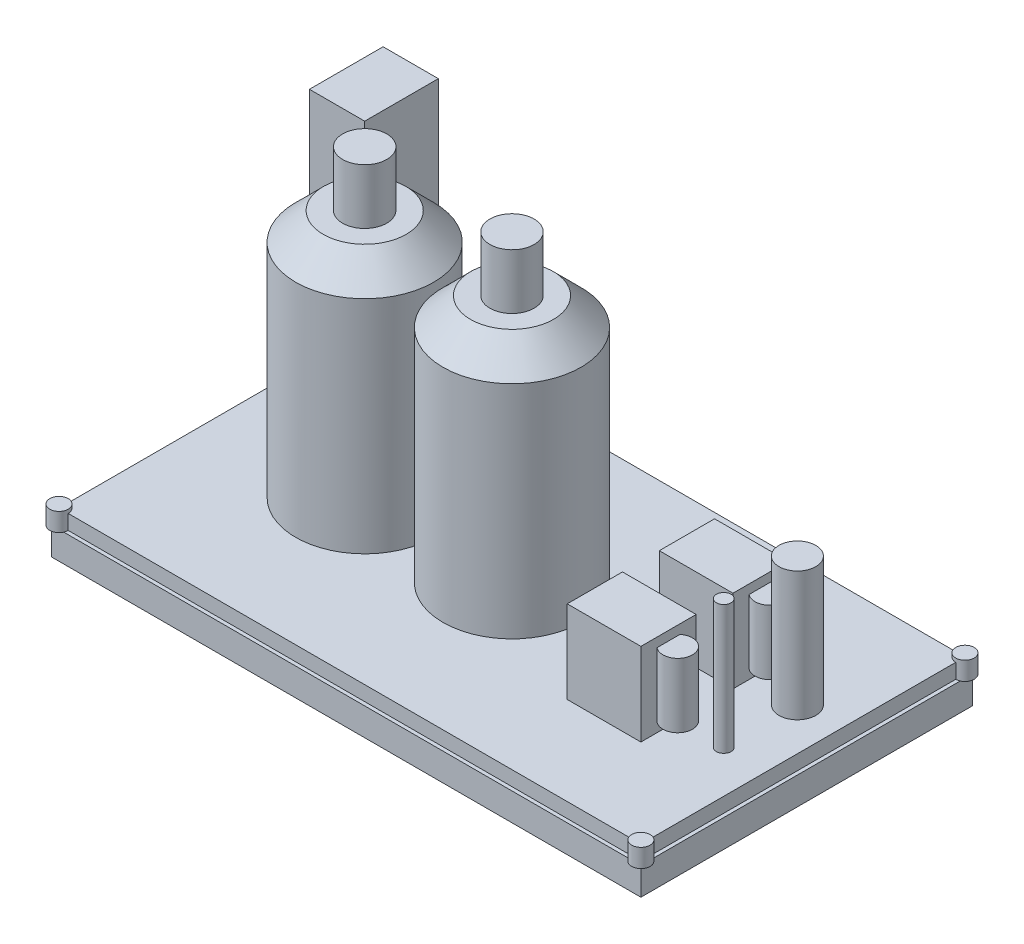
from build123d import *

# Parameters (mm, degrees)
SKETCH1_W                     = 3200
SKETCH1_H                     = 1800
BOSS_EXTRUDE1_DEPTH           = 150
BOSS_EXTRUDE2_START           = 150
SKETCH2_W                     = 3160
SKETCH2_H                     = 1760
BOSS_EXTRUDE2_DEPTH           = 80
BOSS_EXTRUDE3_START           = 15
SKETCH3_W                     = 200
SKETCH3_H                     = 1800
BOSS_EXTRUDE3_DEPTH           = 120
BOSS_EXTRUDE4_START           = 230
SKETCH4_R                     = 375
BOSS_EXTRUDE4_DEPTH           = 1200
BOSS_EXTRUDE5_START           = 1430
SKETCH5_R                     = 375
BOSS_EXTRUDE5_DEPTH           = 150
BOSS_EXTRUDE5_DRAFT           = 45
BOSS_EXTRUDE5_PROFILE_2_DEPTH = 150
BOSS_EXTRUDE5_PROFILE_2_DRAFT = 45
BOSS_EXTRUDE6_START           = 1580
SKETCH6_R                     = 120
BOSS_EXTRUDE6_DEPTH           = 300
BOSS_EXTRUDE7_START           = 230
SKETCH7_W                     = 400
SKETCH7_H                     = 300
BOSS_EXTRUDE7_DEPTH           = 450
BOSS_EXTRUDE8_START           = 280
SKETCH8_R                     = 80
BOSS_EXTRUDE8_DEPTH           = 350
BOSS_EXTRUDE9_START           = 230
SKETCH9_R                     = 100
SKETCH9_R_2                   = 40
BOSS_EXTRUDE9_DEPTH           = 700
BOSS_EXTRUDE10_START          = 150
SKETCH10_W                    = 50
SKETCH10_H                    = 50
BOSS_EXTRUDE10_DEPTH          = 650
BOSS_EXTRUDE11_START          = 800
SKETCH11_W                    = 300
SKETCH11_H                    = 400
BOSS_EXTRUDE11_DEPTH          = 800
BOSS_EXTRUDE12_START          = 150
SKETCH12_R                    = 50
BOSS_EXTRUDE12_DEPTH          = 100


with BuildPart() as part:
    # Sketch1 → Boss-Extrude1 (new body)
    with BuildSketch(Plane(origin=(0, 0, 0), x_dir=(1, 0, 0), z_dir=(0, 1, 0))):
        Rectangle(SKETCH1_W, SKETCH1_H)
    extrude(amount=BOSS_EXTRUDE1_DEPTH)

    # Sketch2 → Boss-Extrude2 (add)
    with BuildSketch(Plane(origin=(0, 0, 0), x_dir=(1, 0, 0), z_dir=(0, 1, 0)).offset(BOSS_EXTRUDE2_START)):
        Rectangle(SKETCH2_W, SKETCH2_H)
    extrude(amount=BOSS_EXTRUDE2_DEPTH)

    # Sketch3 → Boss-Extrude3 (add)
    with BuildSketch(Plane(origin=(0, 0, 0), x_dir=(1, 0, 0), z_dir=(0, 1, 0)).offset(BOSS_EXTRUDE3_START)):
        with Locations((-700, 0)):
            Rectangle(SKETCH3_W, SKETCH3_H)
        with Locations((700, 0)):
            Rectangle(SKETCH3_W, SKETCH3_H)
    extrude(amount=BOSS_EXTRUDE3_DEPTH)

    # Sketch4 → Boss-Extrude4 (add)
    with BuildSketch(Plane(origin=(0, 0, 0), x_dir=(1, 0, 0), z_dir=(0, 1, 0)).offset(BOSS_EXTRUDE4_START)):
        with Locations((-800, 0)):
            Circle(SKETCH4_R)
        Circle(SKETCH4_R)
    extrude(amount=BOSS_EXTRUDE4_DEPTH)


with BuildPart() as boss_extrude5_tool:
    # Sketch5 → Boss-Extrude5 (with draft: the straight prism first)
    with BuildSketch(Plane(origin=(0, 0, 0), x_dir=(1, 0, 0), z_dir=(0, 1, 0)).offset(BOSS_EXTRUDE5_START)):
        with Locations((-800, 0)):
            Circle(SKETCH5_R)
    extrude(amount=BOSS_EXTRUDE5_DEPTH)
    # Boss-Extrude5: the draft: its side faces are tilted about the plane it starts from
    boss_extrude5_sides = [boss_extrude5_tool.faces().sort_by_distance(p)[0] for p in [
        (-1175, 1505, 0),
    ]]
    draft(boss_extrude5_sides, Plane(origin=(0, 0, 0), x_dir=(1, 0, 0), z_dir=(0, 1, 0)).offset(BOSS_EXTRUDE5_START), BOSS_EXTRUDE5_DRAFT)


with BuildPart() as part_1:
    add(part.part)

    # Boss-Extrude5: add boss_extrude5_tool
    add(boss_extrude5_tool.part)


with BuildPart() as boss_extrude5_profile_2_tool:
    # Sketch5 → Boss-Extrude5 profile 2 (with draft: the straight prism first)
    with BuildSketch(Plane(origin=(0, 0, 0), x_dir=(1, 0, 0), z_dir=(0, 1, 0)).offset(BOSS_EXTRUDE5_START)):
        Circle(SKETCH5_R)
    extrude(amount=BOSS_EXTRUDE5_PROFILE_2_DEPTH)
    # Boss-Extrude5 profile 2: the draft: its side faces are tilted about the plane it starts from
    boss_extrude5_profile_2_sides = [boss_extrude5_profile_2_tool.faces().sort_by_distance(p)[0] for p in [
        (-375, 1505, 0),
    ]]
    draft(boss_extrude5_profile_2_sides, Plane(origin=(0, 0, 0), x_dir=(1, 0, 0), z_dir=(0, 1, 0)).offset(BOSS_EXTRUDE5_START), BOSS_EXTRUDE5_PROFILE_2_DRAFT)


with BuildPart() as part_2:
    add(part_1.part)

    # Boss-Extrude5 profile 2: add boss_extrude5_profile_2_tool
    add(boss_extrude5_profile_2_tool.part)

    # Sketch6 → Boss-Extrude6 (add)
    with BuildSketch(Plane(origin=(0, 0, 0), x_dir=(1, 0, 0), z_dir=(0, 1, 0)).offset(BOSS_EXTRUDE6_START)):
        with Locations((-800, 0)):
            Circle(SKETCH6_R)
        Circle(SKETCH6_R)
    extrude(amount=BOSS_EXTRUDE6_DEPTH)

    # Sketch7 → Boss-Extrude7 (add)
    with BuildSketch(Plane(origin=(0, 0, 0), x_dir=(1, 0, 0), z_dir=(0, 1, 0)).offset(BOSS_EXTRUDE7_START)):
        with Locations((900, -250)):
            Rectangle(SKETCH7_W, SKETCH7_H)
        with Locations((900, 250)):
            Rectangle(SKETCH7_W, SKETCH7_H)
    extrude(amount=BOSS_EXTRUDE7_DEPTH)

    # Sketch8 → Boss-Extrude8 (add)
    with BuildSketch(Plane(origin=(0, 0, 0), x_dir=(1, 0, 0), z_dir=(0, 1, 0)).offset(BOSS_EXTRUDE8_START)):
        with Locations((1150, -250)):
            Circle(SKETCH8_R)
        with Locations((1150, 250)):
            Circle(SKETCH8_R)
    extrude(amount=BOSS_EXTRUDE8_DEPTH)

    # Sketch9 → Boss-Extrude9 (add)
    with BuildSketch(Plane(origin=(0, 0, 0), x_dir=(1, 0, 0), z_dir=(0, 1, 0)).offset(BOSS_EXTRUDE9_START)):
        with Locations((1350, 200)):
            Circle(SKETCH9_R)
        with Locations((1350, -200)):
            Circle(SKETCH9_R_2)
    extrude(amount=BOSS_EXTRUDE9_DEPTH)

    # Sketch10 → Boss-Extrude10 (add)
    with BuildSketch(Plane(origin=(0, 0, 0), x_dir=(1, 0, 0), z_dir=(0, 1, 0)).offset(BOSS_EXTRUDE10_START)):
        with Locations((-1455, 445)):
            Rectangle(SKETCH10_W, SKETCH10_H)
        with Locations((-1455, 755)):
            Rectangle(SKETCH10_W, SKETCH10_H)
    extrude(amount=BOSS_EXTRUDE10_DEPTH)

    # Sketch11 → Boss-Extrude11 (add)
    with BuildSketch(Plane(origin=(0, 0, 0), x_dir=(1, 0, 0), z_dir=(0, 1, 0)).offset(BOSS_EXTRUDE11_START)):
        with Locations((-1350, 600)):
            Rectangle(SKETCH11_W, SKETCH11_H)
    extrude(amount=BOSS_EXTRUDE11_DEPTH)

    # Sketch12 → Boss-Extrude12 (add)
    with BuildSketch(Plane(origin=(0, 0, 0), x_dir=(1, 0, 0), z_dir=(0, 1, 0)).offset(BOSS_EXTRUDE12_START)):
        with Locations((-1580, -880)):
            Circle(SKETCH12_R)
        with Locations((1580, -880)):
            Circle(SKETCH12_R)
        with Locations((-1580, 880)):
            Circle(SKETCH12_R)
        with Locations((1580, 880)):
            Circle(SKETCH12_R)
    extrude(amount=BOSS_EXTRUDE12_DEPTH)


solid = part_2.part
